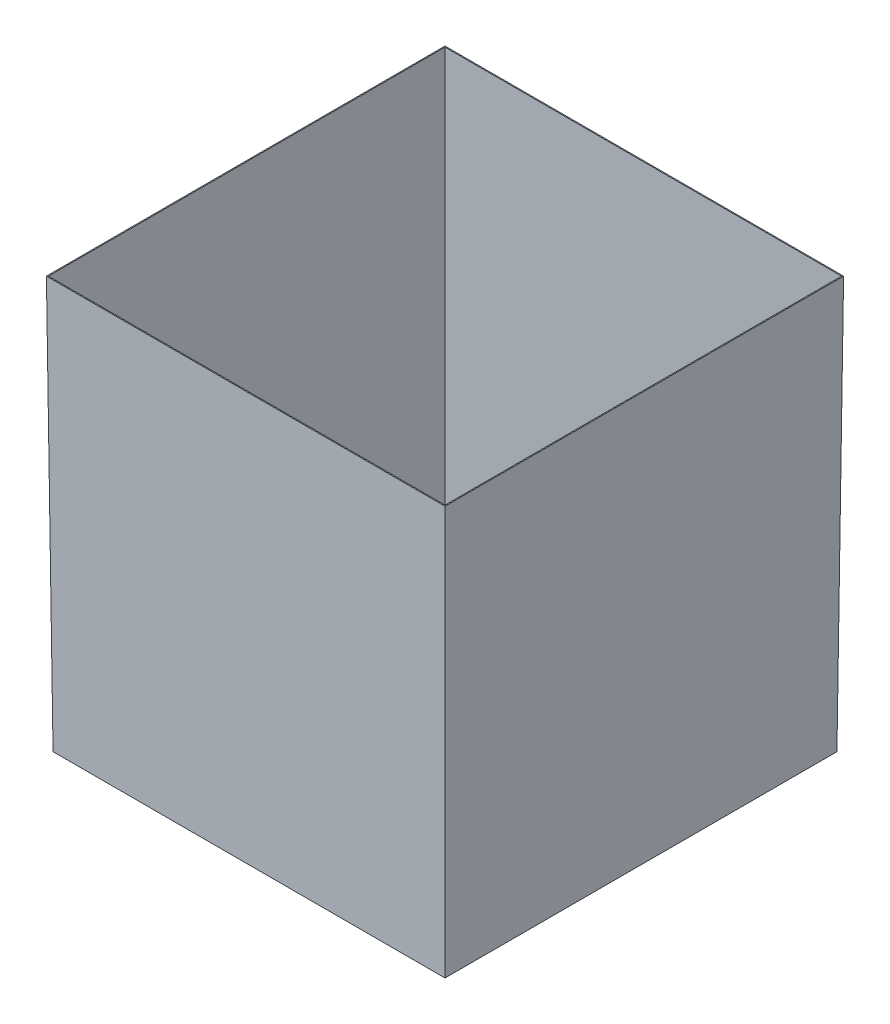
from build123d import *

# Parameters (mm, degrees)
SHELL_1_5_T = -1.5


with BuildPart() as part:
    # Эскиз1 → Корпус 590-600, H620 section 0
    with BuildSketch(Plane(origin=(0, 0, 0), x_dir=(1, 0, 0), z_dir=(0, 1, 0))):
        with BuildLine():
            Line((-295, -295), (295, -295))
            Line((295, -295), (295, 295))
            Line((295, 295), (-295, 295))
            Line((-295, 295), (-295, -295))
        make_face()
    # Эскиз2 → Корпус 590-600, H620 section 1
    with BuildSketch(Plane(origin=(0, 620, 0), x_dir=(1, 0, 0), z_dir=(0, 1, 0))):
        with BuildLine():
            Line((-300, -300), (300, -300))
            Line((300, -300), (300, 300))
            Line((300, 300), (-300, 300))
            Line((-300, 300), (-300, -300))
        make_face()
    loft()

    # Стенка и дно 1,5 мм
    shell_1_5_openings = [part.faces().sort_by_distance(p)[0] for p in [
        (0, 620, 0),
    ]]
    offset(amount=SHELL_1_5_T, openings=shell_1_5_openings, kind=Kind.INTERSECTION)


solid = part.part
